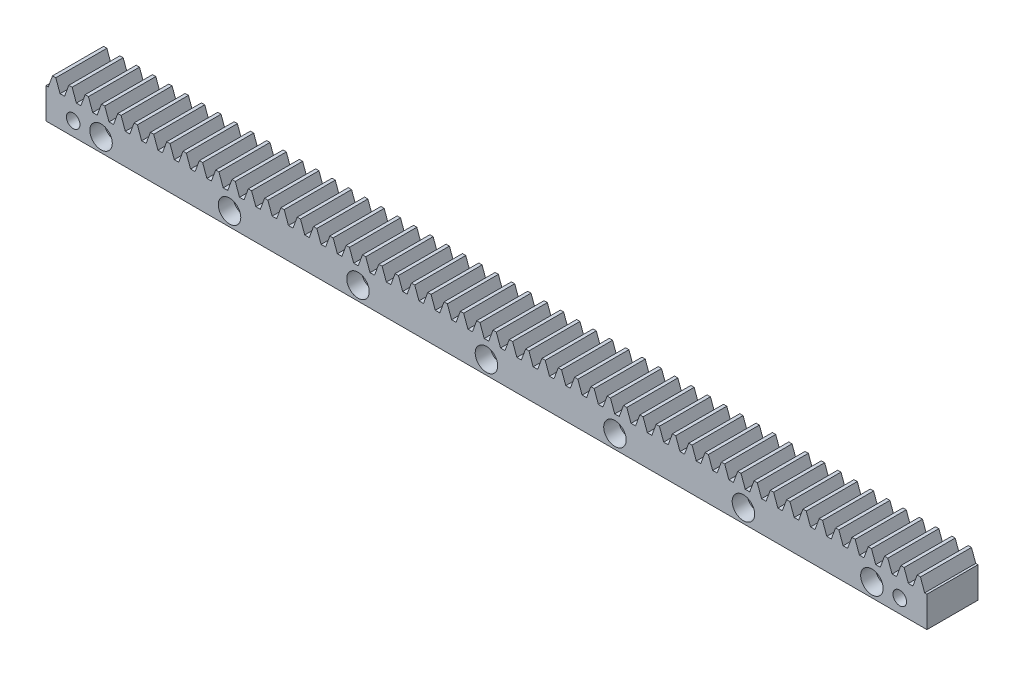
from build123d import *

# Parameters (mm, degrees)
BLANKSKE_W         = 1017.88
BLANKSKE_H         = 49
BLANK_DEPTH        = 59
TOOTHCUTSIM_DEPTH  = 1021.765249409
TEETHCUTS_COUNT    = 56
TEETHCUTS_PITCH    = 18.8495559
SKETCH2_R          = 7.85
CUT_EXTRUDE1_DEPTH = 202
SKETCH3_R          = 9
CUT_EXTRUDE2_DEPTH = 202
SKETCH4_R          = 13
CUT_EXTRUDE3_DEPTH = 17
LPATTERN1_COUNT    = 2
LPATTERN1_PITCH    = 890.68
LPATTERN2_COUNT    = 6
LPATTERN2_PITCH    = 148.44666


with BuildPart() as part:
    # BlankSke → Blank (new body)
    with BuildSketch(Plane.XY):
        with Locations((508.94, 24.5)):
            Rectangle(BLANKSKE_W, BLANKSKE_H)
    extrude(amount=-BLANK_DEPTH)

    # TooCutSkeSim → ToothCutSim (cut, through all)
    with BuildSketch(Plane.XY):
        Polygon((2.603612218, 35.5), (-2.603612218, 35.5), (-7.526455225, 49.0254), (7.526455225, 49.0254), align=None)
    toothcutsim = extrude(amount=-TOOTHCUTSIM_DEPTH, mode=Mode.SUBTRACT)

    # TeethCuts: ToothCutSim ×56
    with Locations(*[(i * TEETHCUTS_PITCH, 0, 0) for i in range(1, TEETHCUTS_COUNT)]):
        add(toothcutsim, mode=Mode.SUBTRACT)

    # Sketch2 → Cut-Extrude1 (cut)
    with BuildSketch(Plane.XY):
        with Locations((31.4, 16)):
            Circle(SKETCH2_R)
        with Locations((986.48, 16)):
            Circle(SKETCH2_R)
    extrude(amount=-CUT_EXTRUDE1_DEPTH, mode=Mode.SUBTRACT)

    # Sketch3 → Cut-Extrude2 (cut)
    with BuildSketch(Plane.XY):
        with Locations((63.6, 16)):
            Circle(SKETCH3_R)
    cut_extrude2 = extrude(amount=-CUT_EXTRUDE2_DEPTH, mode=Mode.SUBTRACT)

    # Sketch4 → Cut-Extrude3 (cut)
    with BuildSketch(Plane.XY):
        with Locations((63.6, 16)):
            Circle(SKETCH4_R)
    cut_extrude3 = extrude(amount=-CUT_EXTRUDE3_DEPTH, mode=Mode.SUBTRACT)

    # LPattern1: Cut-Extrude2, Cut-Extrude3 ×2
    with Locations(*[(i * LPATTERN1_PITCH, 0, 0) for i in range(1, LPATTERN1_COUNT)]):
        add(cut_extrude2, mode=Mode.SUBTRACT)
        add(cut_extrude3, mode=Mode.SUBTRACT)

    # LPattern2: Cut-Extrude2, Cut-Extrude3 ×6
    with Locations(*[(i * LPATTERN2_PITCH, 0, 0) for i in range(1, LPATTERN2_COUNT)]):
        add(cut_extrude2, mode=Mode.SUBTRACT)
        add(cut_extrude3, mode=Mode.SUBTRACT)


solid = part.part
